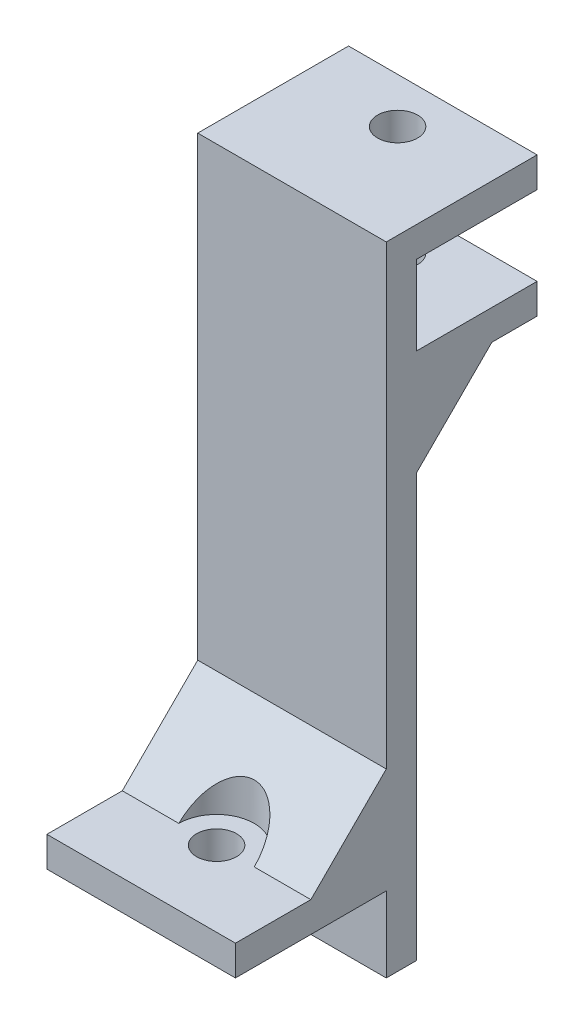
from build123d import *

# Parameters (mm, degrees)
BOSS_EXTRUDE1_DEPTH     = 25
CUT_EXTRUDE1_DEPTH      = 6
CUT_EXTRUDE1_DEPTH_BACK = 6
SKETCH2_R               = 2.65
SKETCH3_R               = 2.65
CUT_EXTRUDE2_DEPTH      = 91.385151574
CHAMFER1_SIZE           = 10
SKETCH4_R               = 5
CUT_EXTRUDE4_DEPTH      = 6
CHAMFER2_SIZE           = 10
SKETCH5_R               = 5
CUT_EXTRUDE5_DEPTH      = 6


with BuildPart() as part:
    # Sketch1 → Boss-Extrude1 (new body)
    with BuildSketch(Plane(origin=(0, 0, 0), x_dir=(0, 0, -1), z_dir=(1, 0, 0))):
        Polygon((0, 0), (0, 10), (-20, 10), (-20, 14), (0, 14), (0, 84.525), (20, 84.525), (20, 80.525), (4, 80.525), (4, 70), (20, 70), (20, 66), (4, 66), (4, 0), align=None)
    extrude(amount=BOSS_EXTRUDE1_DEPTH)

    # Sketch2 → Cut-Extrude1 (cut, two sides: drawn at the far end of the back side and taken through both)
    with BuildSketch(Plane(origin=(0, 14, 0), x_dir=(1, 0, 0), z_dir=(0, 1, 0)).offset(-CUT_EXTRUDE1_DEPTH_BACK)):
        with Locations(Location((12.5, -10, 0), (0, 0, 90))):
            Circle(SKETCH2_R)
    extrude(amount=CUT_EXTRUDE1_DEPTH + CUT_EXTRUDE1_DEPTH_BACK, mode=Mode.SUBTRACT)

    # Sketch3 → Cut-Extrude2 (cut, through all)
    with BuildSketch(Plane(origin=(0, 84.525, 0), x_dir=(1, 0, 0), z_dir=(0, 1, 0))):
        with Locations(Location((12.5, 14, 0), (0, 0, 270))):
            Circle(SKETCH3_R)
    extrude(amount=-CUT_EXTRUDE2_DEPTH, mode=Mode.SUBTRACT)

    # Chamfer1
    # the kernel refuses this chamfer: 10 mm, written as the material it adds along each edge
    with BuildSketch(Plane(origin=(0, 14, 0), x_dir=(0, -0.027495876610586317, 0.9996219169112968), z_dir=(1, 0, 0))) as chamfer1_piece_1_section:
        Polygon((CHAMFER1_SIZE * 0.999621916911, -CHAMFER1_SIZE * 0.0274958766106), (-CHAMFER1_SIZE * 0.0274958766106, -CHAMFER1_SIZE * 0.999621916911), (0, 0), align=None)
    chamfer1_piece_1 = extrude(amount=25, mode=Mode.PRIVATE)
    chamfer1_piece_1 = chamfer1_piece_1 - Plane(origin=(12.5, 17.333000487, 10), x_dir=(0, 0, -1), z_dir=(0, 1, 0)) * Cylinder(2.65, 90, mode=Mode.PRIVATE)
    add(chamfer1_piece_1)

    # Sketch4 → Cut-Extrude4 (cut)
    with BuildSketch(Plane(origin=(0, 14, 0), x_dir=(1, 0, 0), z_dir=(0, 1, 0))):
        with Locations((12.5, -10)):
            Circle(SKETCH4_R)
    extrude(amount=CUT_EXTRUDE4_DEPTH, mode=Mode.SUBTRACT)

    # Chamfer2
    # the kernel refuses this chamfer: 10 mm, written as the material it adds along each edge
    with BuildSketch(Plane(origin=(0, 66, -4), x_dir=(0, -0.9996219169112968, 0.027495876610586233), z_dir=(1, 0, 0))) as chamfer2_piece_1_section:
        Polygon((CHAMFER2_SIZE * 0.999621916911, CHAMFER2_SIZE * 0.0274958766106), (-CHAMFER2_SIZE * 0.0274958766106, CHAMFER2_SIZE * 0.999621916911), (0, 0), align=None)
    chamfer2_piece_1 = extrude(amount=25, mode=Mode.PRIVATE)
    chamfer2_piece_1 = chamfer2_piece_1 - Plane(origin=(12.5, 62.667000224, -14), x_dir=(0, 0, 1), z_dir=(0, 1, 0)) * Cylinder(2.65, 90, mode=Mode.PRIVATE)
    add(chamfer2_piece_1)

    # Sketch5 → Cut-Extrude5 (cut)
    with BuildSketch(Plane.XZ.offset(-66)):
        with Locations((12.5, -14)):
            Circle(SKETCH5_R)
    extrude(amount=CUT_EXTRUDE5_DEPTH, mode=Mode.SUBTRACT)


solid = part.part
